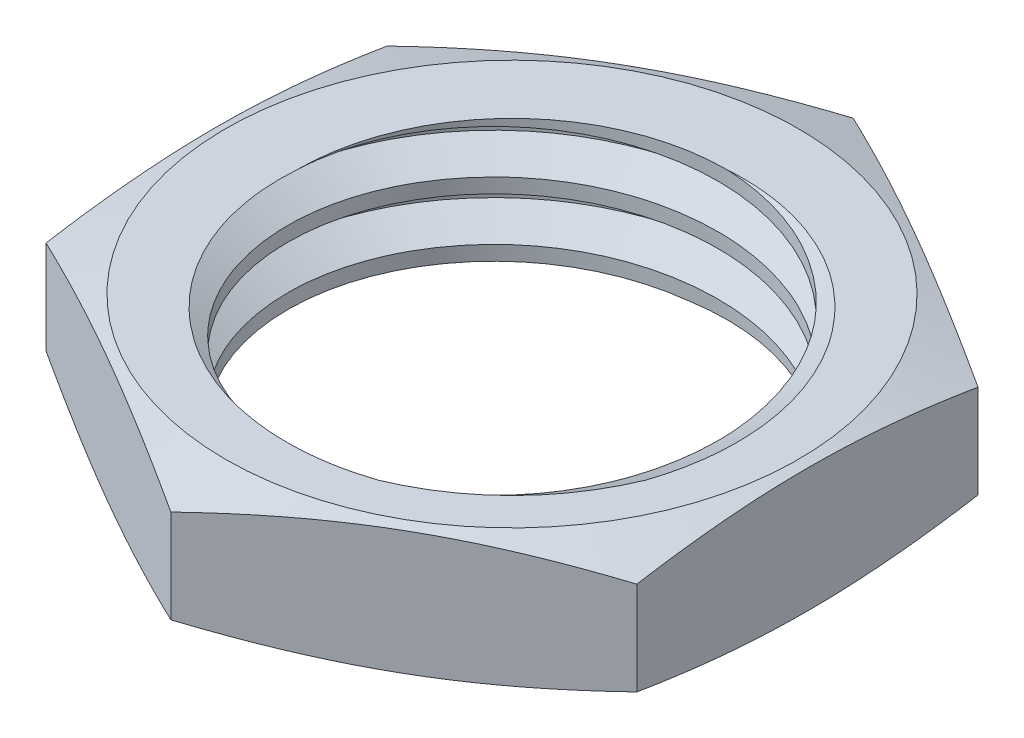
from build123d import *

# Parameters (mm, degrees)
SKETCH1_R           = 2.95
BOSS_EXTRUDE1_DEPTH = 1.78
THREAD1_PITCH       = 0.8


with BuildPart() as part:
    # Sketch1 → Boss-Extrude1 (new body)
    with BuildSketch(Plane(origin=(0, 0, 0), x_dir=(1, 0, 0), z_dir=(0, 1, 0))):
        Polygon((0, -4.67653718), (4.05, -2.33826859), (4.05, 2.33826859), (0, 4.67653718), (-4.05, 2.33826859), (-4.05, -2.33826859), align=None)
        with Locations(Location((0, 0, 0), (0, 0, 270))):
            Circle(SKETCH1_R, mode=Mode.SUBTRACT)
    extrude(amount=BOSS_EXTRUDE1_DEPTH)

    # Sketch2 → Cut-Revolve2 (revolve, cut)
    with BuildSketch(Plane(origin=(0, 0, 0), x_dir=(-0.8660254037844415, 0, -0.4999999999999951), z_dir=(0.4999999999999951, 0, -0.8660254037844415)), mode=Mode.PRIVATE) as cut_revolve2_sk:
        Polygon((-4.67653718, 1.53), (-3.92653718, 1.78), (-4.67653718, 1.78), align=None)
        Polygon((-4.67653718, 0.25), (-3.92653718, 0), (-4.67653718, 0), align=None)
    revolve(cut_revolve2_sk.sketch.rotate(Axis((0, 1.78, 0), (0, -1, 0)), 60), axis=Axis((0, 1.78, 0), (0, -1, 0)), mode=Mode.SUBTRACT)

    # Thread1: the profile of Thread Profile1 profile screwed along a right-hand helix of 3.225 turns, 8 arcs to a turn; built about Z, then put on its axis
    thread1_z = Axis((0, 0, 0), (0, 0, 1))
    thread1_corners = [(2.9497, 0, -0.000173205), (3.3830127, 0, 0.249999999), (3.3830127, 0, 0.349999999), (2.9497, 0, 0.600173203)]
    with BuildLine(mode=Mode.PRIVATE) as thread1_profile:
        Line(thread1_corners[0], thread1_corners[1])
        Line(thread1_corners[1], thread1_corners[2])
        Line(thread1_corners[2], thread1_corners[3])
        Line(thread1_corners[3], thread1_corners[0])
    thread1_cap = Face(thread1_profile.wire())
    thread1_turn_angles = [0, 22.5, 45, 67.5, 90, 112.5, 135, 157.5, 180, 202.5, 225, 247.5, 270, 292.5, 315, 337.5, 360]
    thread1_turn_weights = [1, 0.9238795325112867, 1, 0.9238795325112867, 1, 0.9238795325112867, 1, 0.9238795325112867, 1, 0.9238795325112867, 1, 0.9238795325112867, 1, 0.9238795325112867, 1, 0.9238795325112867, 1]
    thread1_turn_rails = [Edge.make_bspline([Vector(p[0], p[1], 0).rotate(thread1_z, thread1_turn_angles[k]) / thread1_turn_weights[k] + Vector(0, 0, p[2] + THREAD1_PITCH * thread1_turn_angles[k] / 360) for k in range(17)], [0, 0, 0, 1, 1, 2, 2, 3, 3, 4, 4, 5, 5, 6, 6, 7, 7, 8, 8, 8], 2, thread1_turn_weights) for p in thread1_corners]
    thread1_turn_sides = [Face.make_surface_from_curves(thread1_turn_rails[p[0]], thread1_turn_rails[p[1]]) for p in [(0, 1), (1, 2), (2, 3), (3, 0)]]
    thread1_last_angles = [1080, 1102.5, 1125, 1143, 1161]
    thread1_last_weights = [1, 0.9238795325112867, 1, 0.9510565162951535, 1]
    thread1_last_rails = [Edge.make_bspline([Vector(p[0], p[1], 0).rotate(thread1_z, thread1_last_angles[k]) / thread1_last_weights[k] + Vector(0, 0, p[2] + THREAD1_PITCH * thread1_last_angles[k] / 360) for k in range(5)], [0, 0, 0, 1, 1, 2, 2, 2], 2, thread1_last_weights) for p in thread1_corners]
    thread1_last_sides = [Face.make_surface_from_curves(thread1_last_rails[p[0]], thread1_last_rails[p[1]]) for p in [(0, 1), (1, 2), (2, 3), (3, 0)]]
    thread1 = Plane(origin=(0, 2.58, 0), x_dir=(-1, 0, 0), z_dir=(0, -1, 0)) * Solid(Shell([*[p.moved(Location((0, 0, THREAD1_PITCH * i))) for i in range(3) for p in thread1_turn_sides], *thread1_last_sides, thread1_cap, thread1_cap.rotate(thread1_z, 1161).moved(Location((0, 0, THREAD1_PITCH * 1161 / 360)))]))
    add(thread1, mode=Mode.SUBTRACT)


solid = part.part
